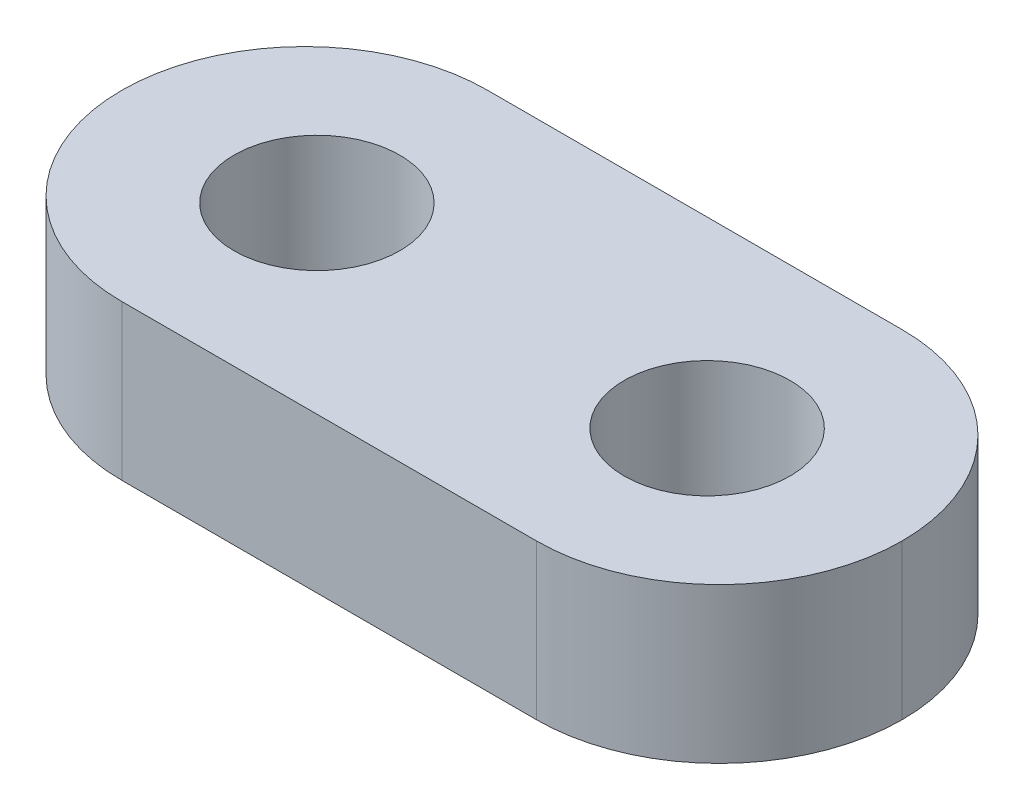
from build123d import *

# Parameters (mm, degrees)
SKETCH2_W                    = 32
SKETCH2_H                    = 15
BOSS_EXTRUDE1_DEPTH          = 6.35
TAP_DRILL_FOR_M8X1_25_TAP1_D = 6.8
FILLET1_R                    = 7.5


with BuildPart() as part:
    # Sketch2 → Boss-Extrude1 (new body)
    with BuildSketch(Plane(origin=(0, 0, 0), x_dir=(1, 0, 0), z_dir=(0, 1, 0))):
        with Locations((16, 7.5)):
            Rectangle(SKETCH2_W, SKETCH2_H)
    extrude(amount=BOSS_EXTRUDE1_DEPTH)

    # Tap Drill for M8x1.25 Tap1 (through all)
    with Locations(Plane(origin=(8, 6.35, -7.5), x_dir=(0, 0, 1), z_dir=(0, 1, 0))):
        with Locations((0, 0), (0, 16)):
            Hole(TAP_DRILL_FOR_M8X1_25_TAP1_D / 2)

    # Fillet1
    fillet1_edges = [part.edges().sort_by_distance(p)[0] for p in [
        (32, 3.175, 0),
        (32, 3.175, -15),
        (0, 3.175, -15),
        (0, 3.175, 0),
    ]]
    fillet(fillet1_edges, radius=FILLET1_R - 0.0001)  # a hair under: the kernel refuses the full size


solid = part.part
